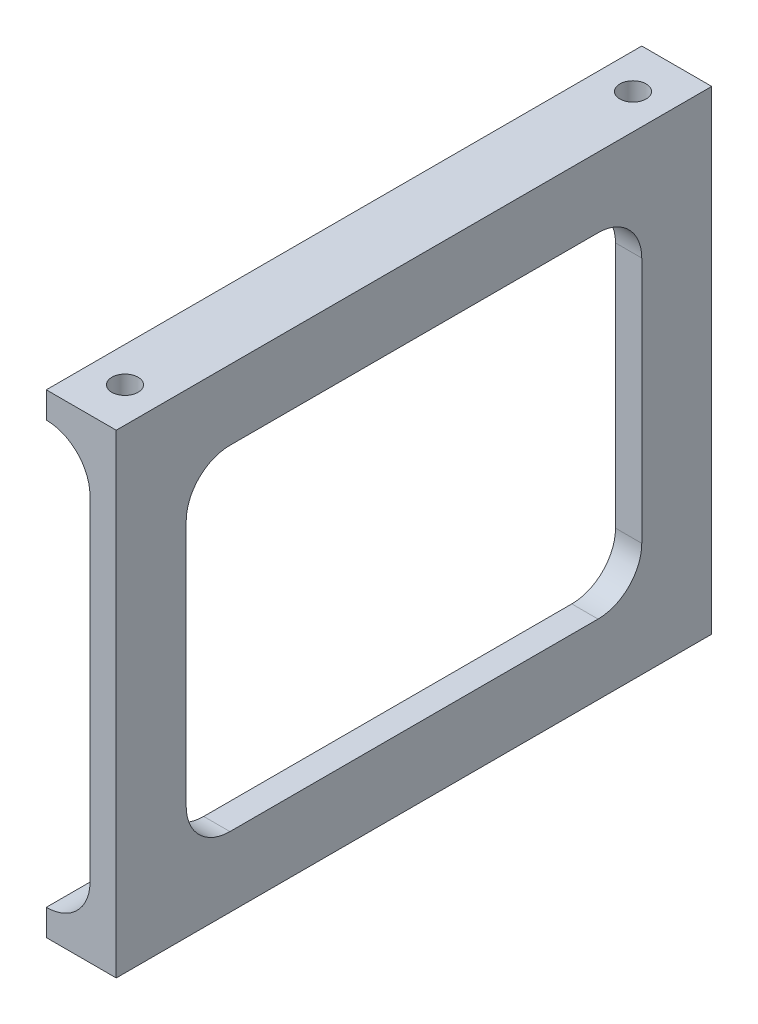
from build123d import *

# Parameters (mm, degrees)
SKETCH1_W                         = 3
SKETCH1_H                         = 68.094259971
MAIN_EXTRUDE_DEPTH                = 54.25
SKETCH2_W                         = 8
SKETCH2_H                         = 68.094259971
TOP_SCREWHOLE_EXTENSION_DEPTH     = 3
SKETCH3_W                         = 8
SKETCH3_H                         = 68.094259971
BOTTOM_SCREWHOLE_EXTENSION_DEPTH  = 3
SCREWHOLE_EXTENSION_FILLETS_5MM_R = 5
SKETCH4_R                         = 1.5
BOTTOM_SCREWHOLES_DEPTH           = 8
TOP_START                         = -8
SKETCH5_R                         = 1.5
TOP_SCREWHOLES_DEPTH              = 8
WEIGHT_REDUCTION_DEPTH            = 101.505676109
WEIGHT_REDUCTION_DEPTH_BACK       = 101.505676109


with BuildPart() as part:
    # Sketch1 → Main extrude (new body)
    with BuildSketch(Plane(origin=(0, -6.84807753, 0), x_dir=(1, 0, 0), z_dir=(0, 1, 0))):
        with Locations((97.25, 54.216388238)):
            Rectangle(SKETCH1_W, SKETCH1_H)
    extrude(amount=MAIN_EXTRUDE_DEPTH)

    # Sketch2 → Top screwhole extension (add)
    with BuildSketch(Plane(origin=(0, 47.40192247, 0), x_dir=(1, 0, 0), z_dir=(0, 1, 0))):
        with Locations((94.75, 54.216388238)):
            Rectangle(SKETCH2_W, SKETCH2_H)
    extrude(amount=-TOP_SCREWHOLE_EXTENSION_DEPTH)

    # Sketch3 → Bottom screwhole extension (add)
    with BuildSketch(Plane.XZ.offset(6.84807753)):
        with Locations((94.75, -54.216388238)):
            Rectangle(SKETCH3_W, SKETCH3_H)
    extrude(amount=-BOTTOM_SCREWHOLE_EXTENSION_DEPTH)

    # Screwhole extension fillets 5mm
    screwhole_extension_fillets_5mm_edges = [part.edges().sort_by_distance(p)[0] for p in [
        (95.75, 44.40192247, -54.216388238),
        (95.75, -3.84807753, -54.216388238),
    ]]
    fillet(screwhole_extension_fillets_5mm_edges, radius=SCREWHOLE_EXTENSION_FILLETS_5MM_R - 0.0001)  # a hair under: the kernel refuses the full size

    # Sketch4 → Bottom screwholes (cut)
    with BuildSketch(Plane.XZ.offset(6.84807753)):
        with Locations(Location((94.75, -25.169258252, 0), (0, 0, 270))):
            Circle(SKETCH4_R)
        with Locations(Location((94.75, -83.263518223, 0), (0, 0, 270))):
            Circle(SKETCH4_R)
    extrude(amount=-BOTTOM_SCREWHOLES_DEPTH, mode=Mode.SUBTRACT)

    # Sketch5 → Top screwholes (cut)
    with BuildSketch(Plane(origin=(0, 47.40192247, 0), x_dir=(1, 0, 0), z_dir=(0, 1, 0)).offset(TOP_START)):
        with Locations(Location((94.75, 25.169258252, 0), (0, 0, 90))):
            Circle(SKETCH5_R)
        with Locations(Location((94.75, 83.263518223, 0), (0, 0, 90))):
            Circle(SKETCH5_R)
    extrude(amount=TOP_SCREWHOLES_DEPTH, mode=Mode.SUBTRACT)

    # Sketch6 → Weight reduction (cut, two sides: drawn at the far end of the back side and taken through both)
    with BuildSketch(Plane(origin=(98.75, 0, 0), x_dir=(0, 0, -1), z_dir=(1, 0, 0)).offset(-WEIGHT_REDUCTION_DEPTH_BACK)):
        with BuildLine():
            Line((28.169258252, 34.40192247), (28.169258252, 6.15192247))
            ThreePointArc((28.169258252, 6.15192247), (29.633724346, 2.616388564), (33.169258252, 1.15192247))
            Line((33.169258252, 1.15192247), (75.263518223, 1.15192247))
            ThreePointArc((75.263518223, 1.15192247), (78.799052129, 2.616388564), (80.263518223, 6.15192247))
            Line((80.263518223, 6.15192247), (80.263518223, 34.40192247))
            ThreePointArc((80.263518223, 34.40192247), (78.799052129, 37.937456376), (75.263518223, 39.40192247))
            Line((75.263518223, 39.40192247), (33.169258252, 39.40192247))
            ThreePointArc((33.169258252, 39.40192247), (29.633724346, 37.937456376), (28.169258252, 34.40192247))
        make_face()
    extrude(amount=WEIGHT_REDUCTION_DEPTH + WEIGHT_REDUCTION_DEPTH_BACK, mode=Mode.SUBTRACT)


solid = part.part
